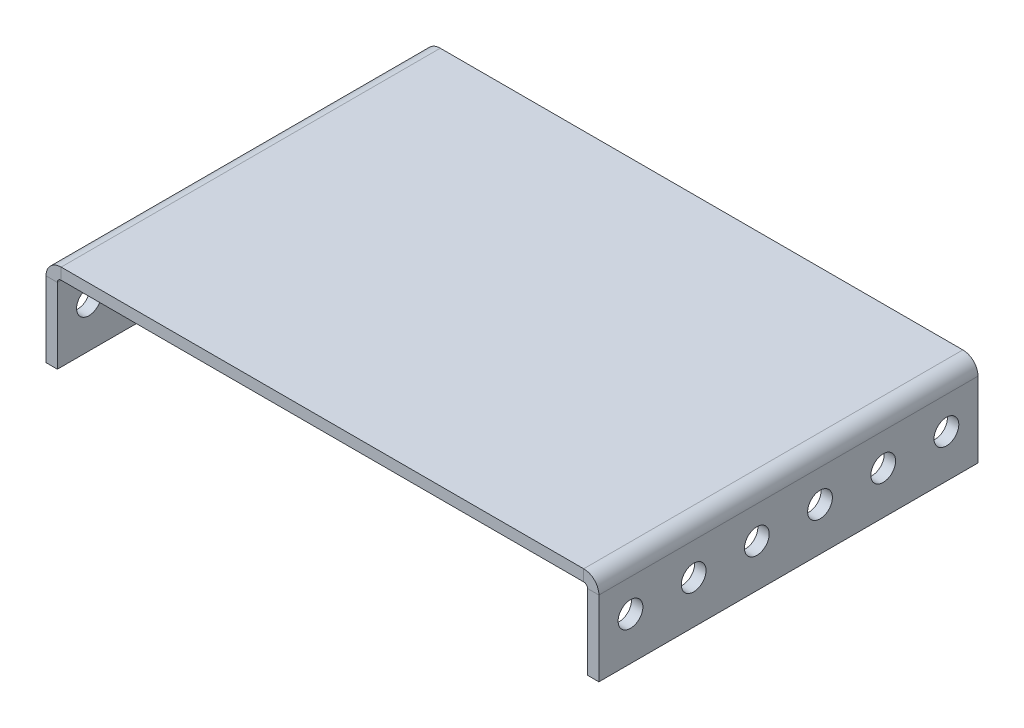
from build123d import *

# Parameters (mm, degrees)
BASE_FLANGE1_DEPTH      = 76.2
CUT_EXTRUDE1_DEPTH      = 95.858586108
CUT_EXTRUDE1_DEPTH_BACK = 95.858586108
SKETCH3_R               = 2.4892


# Sheet-metal steps are written as plain solids
with BuildPart() as part:
    # Sketch1 → Base-Flange1 (new body)
    with BuildSketch(Plane.XY):
        with BuildLine():
            Line((-53.2765, -7.9375), (-53.2765, 7.1755))
            ThreePointArc((-53.2765, 7.1755), (-53.053315367, 7.714315367), (-52.5145, 7.9375))
            Line((-52.5145, 7.9375), (52.5145, 7.9375))
            ThreePointArc((52.5145, 7.9375), (53.053315367, 7.714315367), (53.2765, 7.1755))
            Line((53.2765, 7.1755), (53.2765, -7.9375))
            Line((53.2765, -7.9375), (55.5625, -7.9375))
            Line((55.5625, -7.9375), (55.5625, 7.1755))
            ThreePointArc((55.5625, 7.1755), (54.669761469, 9.330761469), (52.5145, 10.2235))
            Line((52.5145, 10.2235), (-52.5145, 10.2235))
            ThreePointArc((-52.5145, 10.2235), (-54.669761469, 9.330761469), (-55.5625, 7.1755))
            Line((-55.5625, 7.1755), (-55.5625, -7.9375))
            Line((-55.5625, -7.9375), (-53.2765, -7.9375))
        make_face()
    extrude(amount=BASE_FLANGE1_DEPTH)

    # Sketch3 → Cut-Extrude1 (cut, two sides: drawn at the far end of the back side and taken through both)
    with BuildSketch(Plane(origin=(0, 0, 0), x_dir=(0, 0, -1), z_dir=(1, 0, 0)).offset(-CUT_EXTRUDE1_DEPTH_BACK)):
        with Locations((-6.35, 0.6985)):
            Circle(SKETCH3_R)
        with Locations((-19.05, 0.6985)):
            Circle(SKETCH3_R)
        with Locations((-31.75, 0.6985)):
            Circle(SKETCH3_R)
        with Locations((-44.45, 0.6985)):
            Circle(SKETCH3_R)
        with Locations((-57.15, 0.6985)):
            Circle(SKETCH3_R)
        with Locations((-69.85, 0.6985)):
            Circle(SKETCH3_R)
    extrude(amount=CUT_EXTRUDE1_DEPTH + CUT_EXTRUDE1_DEPTH_BACK, mode=Mode.SUBTRACT)


solid = part.part
